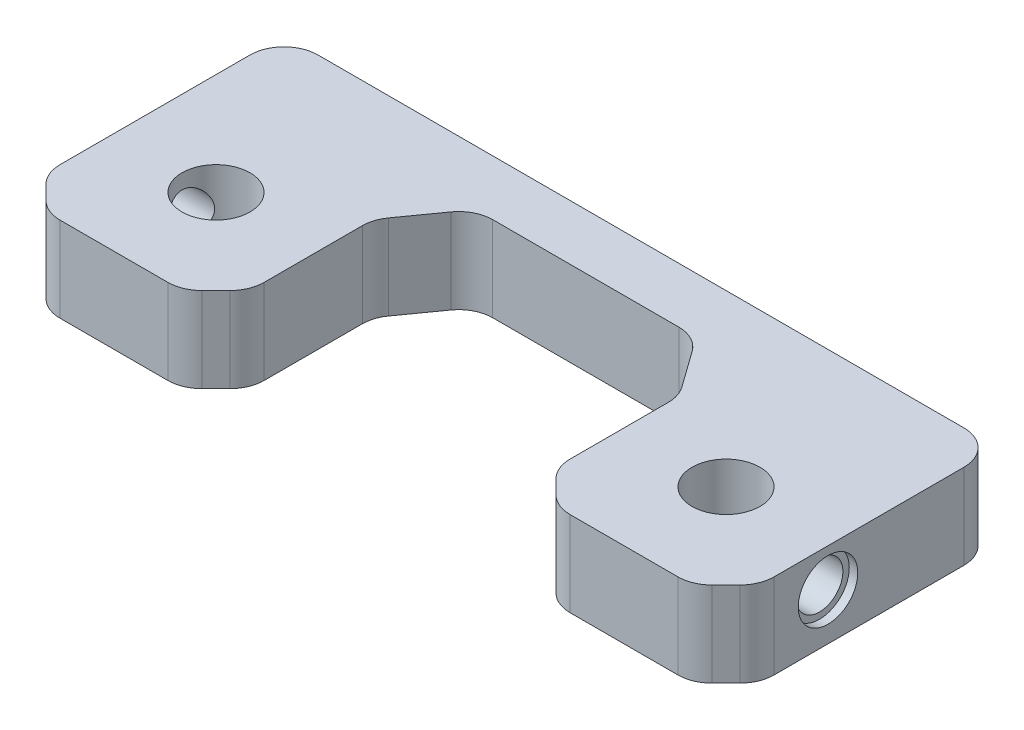
from build123d import *

# Parameters (mm, degrees)
ESQUISSE1_R                 = 4
BOSS_EXTRU_1_DEPTH          = 10
CHANFREIN3_SIZE             = 4
CONG_2_R                    = 4
ESQUISSE3_R                 = 4
BOSS_EXTRU_2_DEPTH          = 2
ENL_V_START                 = -42
ENL_V_MAT_EXTRU_4_OUTLINE_R = 2.75
ENL_V_MAT_EXTRU_4_DEPTH     = 9.0952626
CONG_4_R                    = 4
ESQUISSE7_R                 = 2.75
ENL_V_MAT_EXTRU_5_DEPTH     = 8.5
ESQUISSE7_4_R               = 3.5
ESQUISSE7_4_R_2             = 2.75
ENL_V_MAT_EXTRU_8_DEPTH     = 1
ESQUISSE8_R                 = 3.5
ENL_V_MAT_EXTRU_9_DEPTH     = 1
ENL_V_START_2               = -1
ESQUISSE9_R                 = 3.5
ENL_V_MAT_EXTRU_10_DEPTH    = 1


# Read off the part's stored shape, not the designer's step: Enlèv. mat.-Extru.4
with BuildPart() as part:
    # Esquisse1 → Boss.-Extru.1 (new body)
    # profile 1 of 4: a face of its own
    with BuildSketch(Plane(origin=(0, 0, 0), x_dir=(1, 0, 0), z_dir=(0, 1, 0))):
        Polygon((-18, 6.5), (-18, 12), (-18, 13.5), (-13, 13.5), (0, 13.5), (0, 20), (-42, 20), (-42, 12), (-42, 0), (-42, -12), (-18, -12), align=None)
        with Locations(Location((-30, 0, 0), (0, 0, 270))):
            Circle(ESQUISSE1_R, mode=Mode.SUBTRACT)
    # profile 2 of 4: a face of its own
    with BuildSketch(Plane(origin=(0, 0, 0), x_dir=(1, 0, 0), z_dir=(0, 1, 0))):
        Polygon((0, 20), (0, 13.5), (13, 13.5), (18, 13.5), (18, 12), (18, 6.5), (18, -12), (42, -12), (42, 0), (42, 12), (42, 20), align=None)
        with Locations(Location((30, 0, 0), (0, 0, 270))):
            Circle(ESQUISSE1_R, mode=Mode.SUBTRACT)
    # profile 3 of 4: a face of its own
    with BuildSketch(Plane(origin=(0, 0, 0), x_dir=(1, 0, 0), z_dir=(0, 1, 0))):
        Polygon((-18, 13.5), (-18, 12), (-18, 6.5), (-13, 13.5), align=None)
    # profile 4 of 4: a face of its own
    with BuildSketch(Plane(origin=(0, 0, 0), x_dir=(1, 0, 0), z_dir=(0, 1, 0))):
        Polygon((18, 13.5), (13, 13.5), (18, 6.5), (18, 12), align=None)
    extrude(amount=BOSS_EXTRU_1_DEPTH)

    # Chanfrein3
    chanfrein3_edges = [part.edges().sort_by_distance(p)[0] for p in [
        (-18, 5, 12),
        (-42, 5, 12),
        (42, 5, 12),
        (18, 5, 12),
    ]]
    chamfer(chanfrein3_edges, length=CHANFREIN3_SIZE)

    # Congé2
    cong_2_edges = [part.edges().sort_by_distance(p)[0] for p in [
        (42, 5, 8),
        (22, 5, 12),
        (38, 5, 12),
        (18, 5, 8),
        (-22, 5, 12),
        (-38, 5, 12),
        (-42, 5, 8),
        (-18, 5, 8),
    ]]
    fillet(cong_2_edges, radius=CONG_2_R)

    # Esquisse3 → Boss.-Extru.2 (add)
    with BuildSketch(Plane.XZ):
        with Locations(Location((-30, 0, 0), (0, 0, 270))):
            Circle(ESQUISSE3_R)
        with Locations(Location((30, 0, 0), (0, 0, 90))):
            Circle(ESQUISSE3_R)
    extrude(amount=-BOSS_EXTRU_2_DEPTH)

    # Enlèv. mat.-Extru.4 outline → Enlèv. mat.-Extru.4 (cut)
    with BuildSketch(Plane.YZ.offset(ENL_V_START)):
        with Locations((5.5, 0)):
            Circle(ENL_V_MAT_EXTRU_4_OUTLINE_R)
    enl_v_mat_extru_4 = extrude(amount=ENL_V_MAT_EXTRU_4_DEPTH, mode=Mode.SUBTRACT)

    # Symétrie10: Enlèv. mat.-Extru.4 across plane
    add(enl_v_mat_extru_4.mirror(Plane(origin=(0, 0, 0), x_dir=(0, 0, 1), z_dir=(1, 0, 0))), mode=Mode.SUBTRACT)

    # Congé4
    cong_4_edges = [part.edges().sort_by_distance(p)[0] for p in [
        (-42, 5, -20),
        (42, 5, -20),
        (18, 5, -6.5),
        (13, 5, -13.5),
        (-13, 5, -13.5),
        (-18, 5, -6.5),
    ]]
    fillet(cong_4_edges, radius=CONG_4_R)

    # Esquisse7 → Enlèv. mat.-Extru.5 (cut)
    with BuildSketch(Plane.XZ):
        with Locations(Location((-35, -13, 0), (0, 0, 270))):
            Circle(ESQUISSE7_R)
        with Locations(Location((35, -13, 0), (0, 0, 270))):
            Circle(ESQUISSE7_R)
    extrude(amount=-ENL_V_MAT_EXTRU_5_DEPTH, mode=Mode.SUBTRACT)

    # Esquisse7<4> → Enlèv. mat.-Extru.8 (cut)
    # profile 1 of 2: a face of its own
    with BuildSketch(Plane.XZ):
        with Locations(Location((-35, -13, 0), (0, 0, 270))):
            Circle(ESQUISSE7_4_R)
        with Locations(Location((-35, -13, 0), (0, 0, 270))):
            Circle(ESQUISSE7_4_R_2, mode=Mode.SUBTRACT)
    # profile 2 of 2: a face of its own
    with BuildSketch(Plane.XZ):
        with Locations(Location((35, -13, 0), (0, 0, 270))):
            Circle(ESQUISSE7_4_R)
        with Locations(Location((35, -13, 0), (0, 0, 270))):
            Circle(ESQUISSE7_4_R_2, mode=Mode.SUBTRACT)
    extrude(amount=-ENL_V_MAT_EXTRU_8_DEPTH, mode=Mode.SUBTRACT)

    # Esquisse8 → Enlèv. mat.-Extru.9 (cut)
    with BuildSketch(Plane.ZY.offset(42)):
        with Locations((0, 5.5)):
            Circle(ESQUISSE8_R)
    extrude(amount=-ENL_V_MAT_EXTRU_9_DEPTH, mode=Mode.SUBTRACT)

    # Esquisse9 → Enlèv. mat.-Extru.10 (cut)
    with BuildSketch(Plane(origin=(42, 0, 0), x_dir=(0, 0, -1), z_dir=(1, 0, 0)).offset(ENL_V_START_2)):
        with Locations(Location((0, 5.5, 0), (0, 0, 180))):
            Circle(ESQUISSE9_R)
    extrude(amount=ENL_V_MAT_EXTRU_10_DEPTH, mode=Mode.SUBTRACT)


solid = part.part
